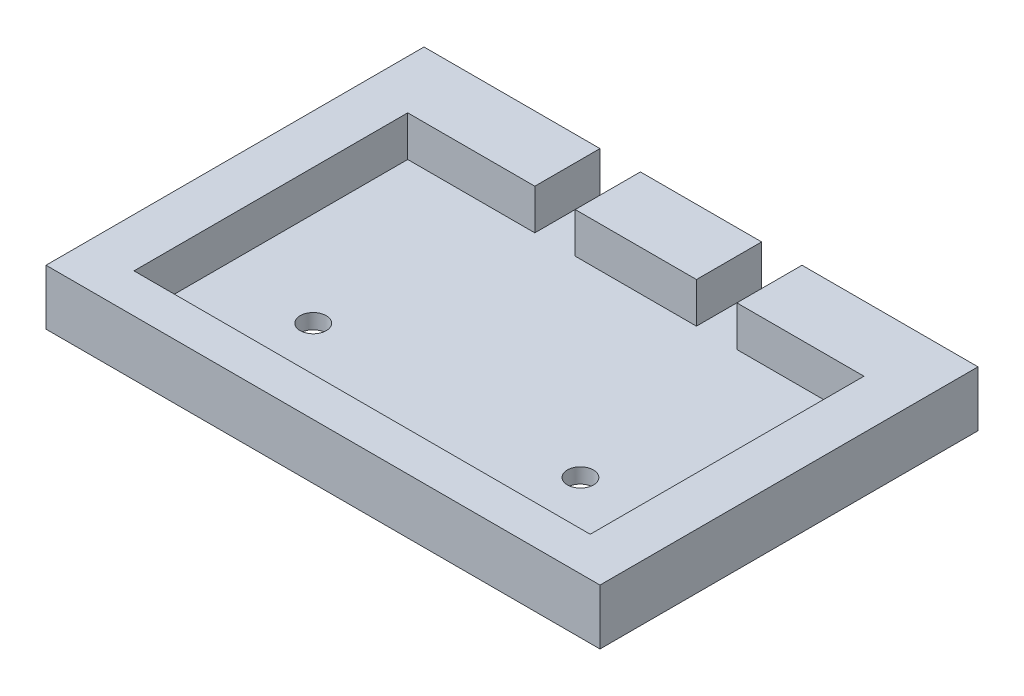
from build123d import *

# Parameters (mm, degrees)
SKETCH1_W           = 91
SKETCH1_H           = 70
BOSS_EXTRUDE1_DEPTH = 12
SKETCH2_R           = 2
CUT_EXTRUDE1_DEPTH  = 59.645119149
SKETCH4_W           = 6.2
SKETCH4_H           = 6.2
CUT_EXTRUDE2_DEPTH  = 15
SKETCH5_W           = 70
SKETCH5_H           = 42
CUT_EXTRUDE3_DEPTH  = 6.2
SKETCH6_W           = 109.081458423
SKETCH6_H           = 97.427456455
SKETCH6_W_2         = 85
SKETCH6_H_2         = 75.166710869
CUT_EXTRUDE4_DEPTH  = 28
SKETCH7_W           = 85
SKETCH7_H           = 3.5
CUT_EXTRUDE5_DEPTH  = 82.081748871
FILLET3_R           = 10
SKETCH8_W           = 85
SKETCH8_H           = 10
CUT_EXTRUDE7_DEPTH  = 17


with BuildPart() as part:
    # Sketch1 → Boss-Extrude1 (new body)
    with BuildSketch(Plane(origin=(0, 0, 0), x_dir=(1, 0, 0), z_dir=(0, 1, 0))):
        Rectangle(SKETCH1_W, SKETCH1_H)
    extrude(amount=BOSS_EXTRUDE1_DEPTH)

    # Sketch2 → Cut-Extrude1 (cut, through all)
    with BuildSketch(Plane(origin=(0, 12, 0), x_dir=(1, 0, 0), z_dir=(0, 1, 0))):
        with Locations(Location((-20.5, -4, 0), (0, 0, 270))):
            Circle(SKETCH2_R)
        with Locations(Location((20.5, -4, 0), (0, 0, 270))):
            Circle(SKETCH2_R)
    extrude(amount=-CUT_EXTRUDE1_DEPTH, mode=Mode.SUBTRACT)

    # Sketch4 → Cut-Extrude2 (cut)
    with BuildSketch(Plane(origin=(0, 0, -35), x_dir=(-1, 0, 0), z_dir=(0, 0, -1))):
        with Locations((-12.4, 8.9)):
            Rectangle(SKETCH4_W, SKETCH4_H)
        with Locations((12.4, 8.9)):
            Rectangle(SKETCH4_W, SKETCH4_H)
    extrude(amount=-CUT_EXTRUDE2_DEPTH, mode=Mode.SUBTRACT)

    # Sketch5 → Cut-Extrude3 (cut)
    with BuildSketch(Plane(origin=(0, 12, 0), x_dir=(1, 0, 0), z_dir=(0, 1, 0))):
        with Locations((0, 4)):
            Rectangle(SKETCH5_W, SKETCH5_H)
    extrude(amount=-CUT_EXTRUDE3_DEPTH, mode=Mode.SUBTRACT)

    # Sketch6 → Cut-Extrude4 (cut)
    with BuildSketch(Plane(origin=(0, 12, 0), x_dir=(1, 0, 0), z_dir=(0, 1, 0))):
        with Locations((-1.57183243, 4.07575105)):
            Rectangle(SKETCH6_W, SKETCH6_H)
        with Locations((0, 4.583355434)):
            Rectangle(SKETCH6_W_2, SKETCH6_H_2, mode=Mode.SUBTRACT)
    extrude(amount=-CUT_EXTRUDE4_DEPTH, mode=Mode.SUBTRACT)

    # Sketch7 → Cut-Extrude5 (cut, through all)
    with BuildSketch(Plane(origin=(0, 0, -35), x_dir=(-1, 0, 0), z_dir=(0, 0, -1))):
        with Locations((0, 1.75)):
            Rectangle(SKETCH7_W, SKETCH7_H)
    extrude(amount=-CUT_EXTRUDE5_DEPTH, mode=Mode.SUBTRACT)

    # Fillet3
    # the kernel refuses this fillet: 10 mm, written as the material it takes off along each edge
    with BuildSketch(Plane(origin=(-67.217149917, 3.5, 33), x_dir=(0, 0, -1), z_dir=(1, 0, 0))) as fillet3_piece_1:
        with BuildLine():
            CenterArc((9.886859967, 10), FILLET3_R, 188.626926559, 81.373073441)
            Line((0, 8.5), (-0.197737199, 8.47))
            ThreePointArc((-0.197737199, 8.47), (-0.2, 4.25), (-0.2, 0))
            Line((-0.2, 0), (0, -0.2))
            Line((0, -0.2), (9.886859967, -0.2))
            Line((9.886859967, -0.2), (9.886859967, 0))
        make_face()
    extrude(amount=134.434299833, mode=Mode.SUBTRACT)

    # Sketch8 → Cut-Extrude7 (cut)
    with BuildSketch(Plane(origin=(0, 12, 0), x_dir=(1, 0, 0), z_dir=(0, 1, 0))):
        with Locations((0, -28)):
            Rectangle(SKETCH8_W, SKETCH8_H)
    extrude(amount=-CUT_EXTRUDE7_DEPTH, mode=Mode.SUBTRACT)


solid = part.part
